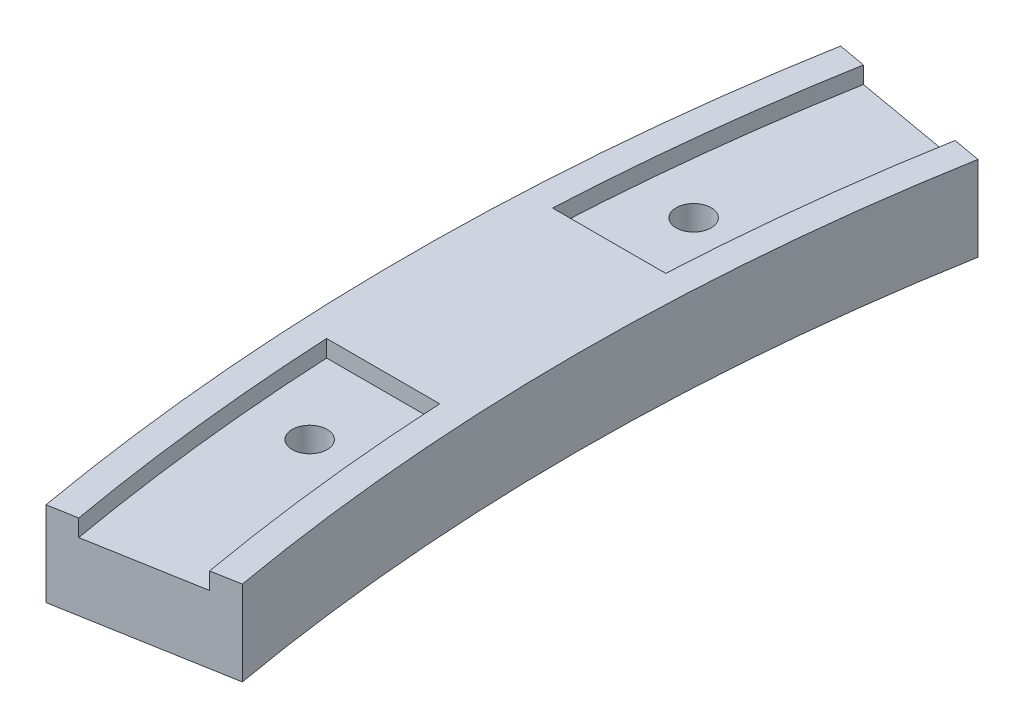
from build123d import *

# Parameters (mm, degrees)
BOSS_EXTRUDE1_DEPTH        = 7.5
CUT_EXTRUDE1_DEPTH         = 1.5
F_3_1_3_1_DIAMETER_HOLE1_D = 3.1


with BuildPart() as part:
    # Sketch1 → Boss-Extrude1 (new body)
    with BuildSketch(Plane(origin=(0, 0, 0), x_dir=(1, 0, 0), z_dir=(0, 1, 0))):
        with BuildLine():
            Line((-199.423569985, 35.163755978), (-184.65145369, 32.559033313))
            ThreePointArc((-184.65145369, 32.559033313), (-187.5, 0), (-184.65145369, -32.559033313))
            Line((-184.65145369, -32.559033313), (-199.423569985, -35.163755978))
            ThreePointArc((-199.423569985, -35.163755978), (-202.5, 0), (-199.423569985, 35.163755978))
        make_face()
    extrude(amount=BOSS_EXTRUDE1_DEPTH)

    # Sketch2 → Cut-Extrude1 (cut)
    with BuildSketch(Plane(origin=(0, 7.5, 0), x_dir=(1, 0, 0), z_dir=(0, 1, 0))):
        with BuildLine():
            Line((-187.113473072, 32.993153757), (-196.961550602, 34.729635533))
            ThreePointArc((-196.961550602, 34.729635533), (-198.7407137, 22.408228804), (-199.749843554, 10))
            Line((-199.749843554, 10), (-189.73665961, 10))
            ThreePointArc((-189.73665961, 10), (-188.775466906, 21.536552519), (-187.113473072, 32.993153757))
        make_face()
        with BuildLine():
            Line((-189.73665961, -10), (-199.749843554, -10))
            ThreePointArc((-199.749843554, -10), (-198.7407137, -22.408228804), (-196.961550602, -34.729635533))
            Line((-196.961550602, -34.729635533), (-187.113473072, -32.993153757))
            ThreePointArc((-187.113473072, -32.993153757), (-188.775466906, -21.536552519), (-189.73665961, -10))
        make_face()
    extrude(amount=-CUT_EXTRUDE1_DEPTH, mode=Mode.SUBTRACT)

    # Ø3.1 (3.1) Diameter Hole1 (through all)
    with Locations(Plane(origin=(0, 0, 0), x_dir=(-1, 0, 0), z_dir=(0, -1, 0))):
        with Locations((194.257966128, -16.995369836), (194.257966128, 16.995369836)):
            Hole(F_3_1_3_1_DIAMETER_HOLE1_D / 2)


solid = part.part
